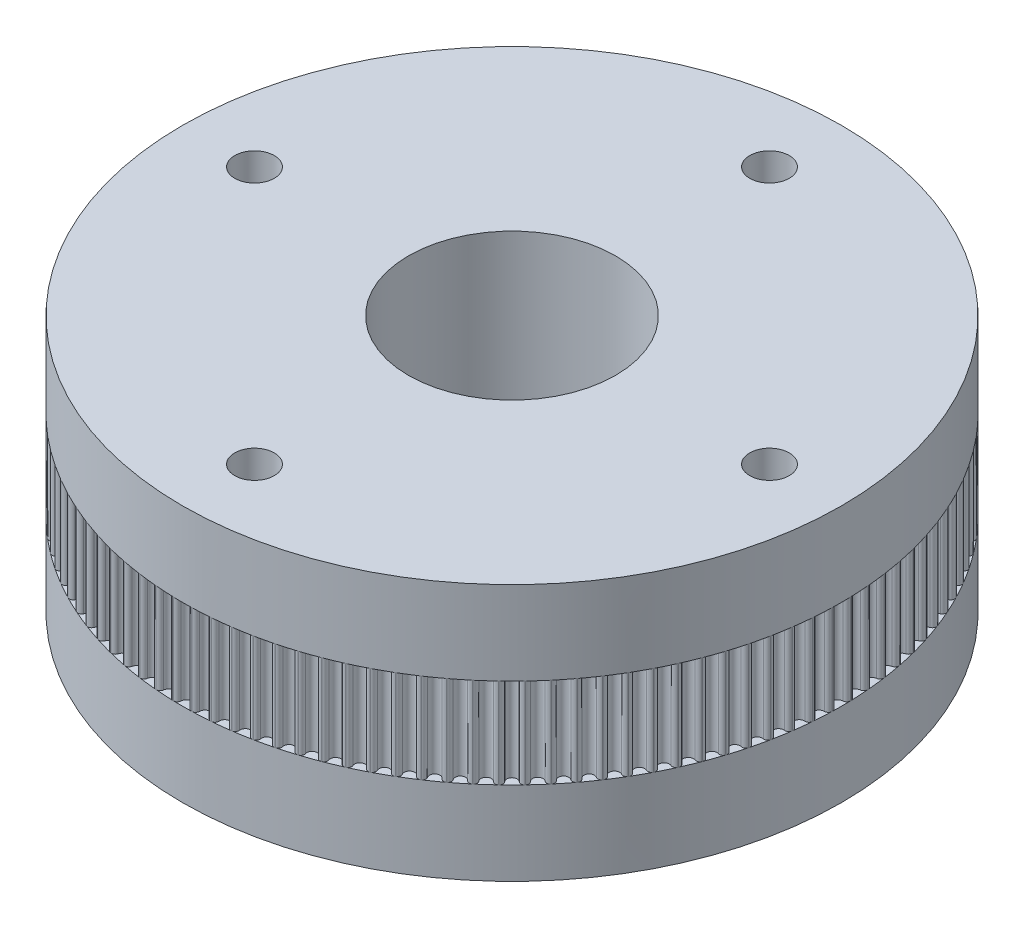
from build123d import *
from build123d.topology import SkipClean

# Parameters (mm, degrees)
CUT_EXTRUDE3_DEPTH  = 25
CIRPATTERN1_COUNT   = 112
SKETCH7_R           = 2.1
CUT_EXTRUDE5_DEPTH  = 51.392236372
CIRPATTERN2_COUNT   = 4
CIRPATTERN2_ANGLE   = 270
BOSS_EXTRUDE1_START = 8.875
SKETCH8_R           = 35
SKETCH8_R_2         = 2.1
SKETCH8_R_3         = 11
BOSS_EXTRUDE1_DEPTH = 8.875


with BuildPart() as part:
    # Skica2 → Revolute (revolve)
    with BuildSketch(Plane.XY):
        Polygon((8.10699967, -4.775), (11, -4.775), (11, 4.775), (12.5, 4.775), (36, 4.775), (36, 3.775), (35, 3.775), (35, -3.775), (36, -3.775), (36, -4.775), align=None)
    revolve(axis=Axis((0, -9, 0), (0, 1, 0)))

    # Sketch2 → Cut-Extrude3 (cut, symmetric)
    with BuildSketch(Plane.XZ.offset(-3.775)):
        with BuildLine():
            ThreePointArc((-0.549870829, 34.59563039), (0, 34.057549754), (0.549870829, 34.59563039))
            ThreePointArc((0.549870829, 34.59563039), (0.673966395, 34.876666046), (0.960756966, 34.98681103))
            ThreePointArc((0.960756966, 34.98681103), (1.741617328, 34.956641273), (2.521609506, 34.909045898))
            ThreePointArc((2.521609506, 34.909045898), (1.685070228, 36.378232566), (0, 36.240952722))
            ThreePointArc((0, 36.240952722), (-1.685070228, 36.378232566), (-2.521609506, 34.909045898))
            ThreePointArc((-2.521609506, 34.909045898), (-1.741617328, 34.956641273), (-0.960756966, 34.98681103))
            ThreePointArc((-0.960756966, 34.98681103), (-0.673966395, 34.876666046), (-0.549870829, 34.59563039))
        make_face()
    cut_extrude3 = extrude(amount=CUT_EXTRUDE3_DEPTH, both=True, mode=Mode.SUBTRACT)

    # CirPattern1: Cut-Extrude3 ×112 about axis
    with SkipClean():  # the faces are left unmerged after this step: merging them gives an invalid solid
        cirpattern1_axis = Axis((0, 0, 0), (0, 1, 0))
        for i in range(1, CIRPATTERN1_COUNT):
            add(cut_extrude3.rotate(cirpattern1_axis, i * 360 / CIRPATTERN1_COUNT), mode=Mode.SUBTRACT)

    # Sketch7 → Cut-Extrude5 (cut, through all)
    with BuildSketch(Plane.XZ.offset(4.775)):
        with Locations((-27.35, 0)):
            Circle(SKETCH7_R)
    cut_extrude5 = extrude(amount=-CUT_EXTRUDE5_DEPTH, mode=Mode.SUBTRACT)

    # CirPattern2: Cut-Extrude5 ×4 about axis
    cirpattern2_axis = Axis((0, 0, 0), (0, -1, 0))
    for i in range(1, CIRPATTERN2_COUNT):
        add(cut_extrude5.rotate(cirpattern2_axis, i * CIRPATTERN2_ANGLE / (CIRPATTERN2_COUNT - 1)), mode=Mode.SUBTRACT)

    # Sketch8 → Boss-Extrude1 (add)
    with BuildSketch(Plane.XZ.offset(4.775).offset(BOSS_EXTRUDE1_START)):
        Circle(SKETCH8_R)
        with Locations((-27.35, 0)):
            Circle(SKETCH8_R_2, mode=Mode.SUBTRACT)
        with Locations((0, 27.35)):
            Circle(SKETCH8_R_2, mode=Mode.SUBTRACT)
        with Locations((27.35, 0)):
            Circle(SKETCH8_R_2, mode=Mode.SUBTRACT)
        with Locations((0, -27.35)):
            Circle(SKETCH8_R_2, mode=Mode.SUBTRACT)
        Circle(SKETCH8_R_3, mode=Mode.SUBTRACT)
    boss_extrude1 = extrude(amount=-BOSS_EXTRUDE1_DEPTH)

    # Mirror2: Boss-Extrude1 across plane
    with SkipClean():  # the faces are left unmerged after this step: merging them gives an invalid solid
        add(boss_extrude1.mirror(Plane.ZX))


solid = part.part
